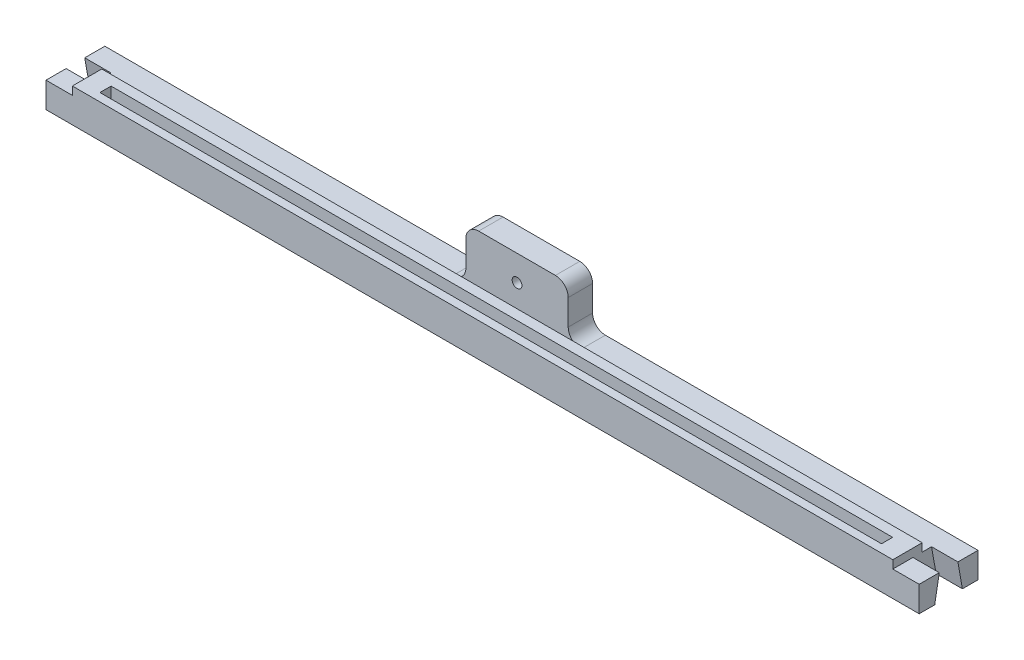
from build123d import *
from OCP.BRepFilletAPI import BRepFilletAPI_MakeChamfer

# Parameters (mm, degrees)
BOSS_EXTRUDE1_DEPTH = 20
SKETCH2_W           = 641.5
SKETCH2_H           = 23
SKETCH2_W_2         = 611.1
SKETCH2_H_2         = 8.73125
BOSS_EXTRUDE2_DEPTH = 6.35
SKETCH4_W           = 80
SKETCH4_H           = 19.05
BOSS_EXTRUDE3_DEPTH = 40
CUT_EXTRUDE2_DEPTH  = 50.8
CHAMFER1_SIZE       = 20
CHAMFER1_SIZE_2     = 3.526539614
SKETCH2_3_W         = 305.55
SKETCH2_3_H         = 8.73125
CUT_EXTRUDE3_DEPTH  = 20
FILLET1_R           = 10


with BuildPart() as part:
    # Sketch1 → Boss-Extrude1 (new body)
    with BuildSketch(Plane(origin=(0, 0, 0), x_dir=(1, 0, 0), z_dir=(0, 1, 0))):
        Polygon((-341.35, 23), (-341.35, 7.291), (-320.75, 7.291), (-320.75, -7.291), (-341.35, -7.291), (-341.35, -23), (341.35, -23), (341.35, -7.291), (320.75, -7.291), (320.75, 7.291), (341.35, 7.291), (341.35, 23), align=None)
    extrude(amount=BOSS_EXTRUDE1_DEPTH)

    # Sketch2 → Boss-Extrude2 (add)
    with BuildSketch(Plane(origin=(0, 20, 0), x_dir=(1, 0, 0), z_dir=(0, 1, 0))):
        with Locations((0, -11.5)):
            Rectangle(SKETCH2_W, SKETCH2_H)
        with Locations((0, -12.284375)):
            Rectangle(SKETCH2_W_2, SKETCH2_H_2, mode=Mode.SUBTRACT)
    extrude(amount=BOSS_EXTRUDE2_DEPTH)

    # Sketch4 → Boss-Extrude3 (add)
    with BuildSketch(Plane(origin=(0, 20, 0), x_dir=(1, 0, 0), z_dir=(0, 1, 0))):
        with Locations((0, 13.475)):
            Rectangle(SKETCH4_W, SKETCH4_H)
    extrude(amount=BOSS_EXTRUDE3_DEPTH)

    # Sketch5 → Cut-Extrude2 (cut)
    with BuildSketch(Plane(origin=(0, 0, -23), x_dir=(-1, 0, 0), z_dir=(0, 0, -1))):
        with BuildLine():
            ThreePointArc((3.407767598, 41.703883799), (0, 43.81), (-3.407767598, 41.703883799))
            Line((-3.407767598, 41.703883799), (0, 40))
            Line((0, 40), (3.407767598, 41.703883799))
        make_face()
        with BuildLine():
            Line((0, 40), (-3.407767598, 41.703883799))
            ThreePointArc((-3.407767598, 41.703883799), (-3.81, 40), (-3.407767598, 38.296116201))
            Line((-3.407767598, 38.296116201), (0, 40))
        make_face()
        with BuildLine():
            Line((3.407767598, 41.703883799), (0, 40))
            Line((0, 40), (3.407767598, 38.296116201))
            ThreePointArc((3.407767598, 38.296116201), (3.70807865, 39.124641373), (3.81, 40))
            ThreePointArc((3.81, 40), (3.70807865, 40.875358627), (3.407767598, 41.703883799))
        make_face()
        with BuildLine():
            Line((3.407767598, 38.296116201), (0, 40))
            Line((0, 40), (-3.407767598, 38.296116201))
            ThreePointArc((-3.407767598, 38.296116201), (0, 36.19), (3.407767598, 38.296116201))
        make_face()
    extrude(amount=-CUT_EXTRUDE2_DEPTH, mode=Mode.SUBTRACT)

    # Chamfer1
    chamfer1_edges_1 = [part.edges().sort_by_distance(p)[0] for p in [
        (331.05, 0, -7.291),
    ]]
    chamfer1_side_1 = [part.faces().sort_by_distance(p)[0] for p in [
        (331.05, 0.070530792, -7.291),
    ]]
    chamfer1_edges_2 = [part.edges().sort_by_distance(p)[0] for p in [
        (331.05, 0, 7.291),
    ]]
    chamfer1_side_2 = [part.faces().sort_by_distance(p)[0] for p in [
        (331.05, 0, 7.361530792),
    ]]
    chamfer1_edges_3 = [part.edges().sort_by_distance(p)[0] for p in [
        (-331.05, 0, 7.291),
    ]]
    chamfer1_side_3 = [part.faces().sort_by_distance(p)[0] for p in [
        (-331.05, 0, 7.361530792),
    ]]
    chamfer1_edges_4 = [part.edges().sort_by_distance(p)[0] for p in [
        (-331.05, 0, -7.291),
    ]]
    chamfer1_side_4 = [part.faces().sort_by_distance(p)[0] for p in [
        (-331.05, 0, -7.361530792),
    ]]
    chamfer1 = BRepFilletAPI_MakeChamfer(part.part.solid().wrapped)
    for e in chamfer1_edges_1:
        chamfer1.Add(CHAMFER1_SIZE - 0.0001, CHAMFER1_SIZE_2 - 0.0001, e.wrapped, chamfer1_side_1[0].wrapped)
    for e in chamfer1_edges_2:
        chamfer1.Add(CHAMFER1_SIZE_2 - 0.0001, CHAMFER1_SIZE - 0.0001, e.wrapped, chamfer1_side_2[0].wrapped)
    for e in chamfer1_edges_3:
        chamfer1.Add(CHAMFER1_SIZE_2 - 0.0001, CHAMFER1_SIZE - 0.0001, e.wrapped, chamfer1_side_3[0].wrapped)
    for e in chamfer1_edges_4:
        chamfer1.Add(CHAMFER1_SIZE_2 - 0.0001, CHAMFER1_SIZE - 0.0001, e.wrapped, chamfer1_side_4[0].wrapped)
    add(Compound.cast(chamfer1.Shape()), mode=Mode.REPLACE)  # a hair under: the kernel refuses the full size

    # Sketch2<3> → Cut-Extrude3 (cut)
    with BuildSketch(Plane(origin=(0, 20, 0), x_dir=(1, 0, 0), z_dir=(0, 1, 0))):
        with Locations((-152.775, -12.284375)):
            Rectangle(SKETCH2_3_W, SKETCH2_3_H)
        with Locations((152.775, -12.284375)):
            Rectangle(SKETCH2_3_W, SKETCH2_3_H)
    extrude(amount=-CUT_EXTRUDE3_DEPTH, mode=Mode.SUBTRACT)

    # Fillet1
    fillet1_edges = [part.edges().sort_by_distance(p)[0] for p in [
        (40, 20, -13.475),
        (-40, 60, -13.475),
        (40, 60, -13.475),
        (-40, 20, -13.475),
    ]]
    fillet(fillet1_edges, radius=FILLET1_R)


solid = part.part
